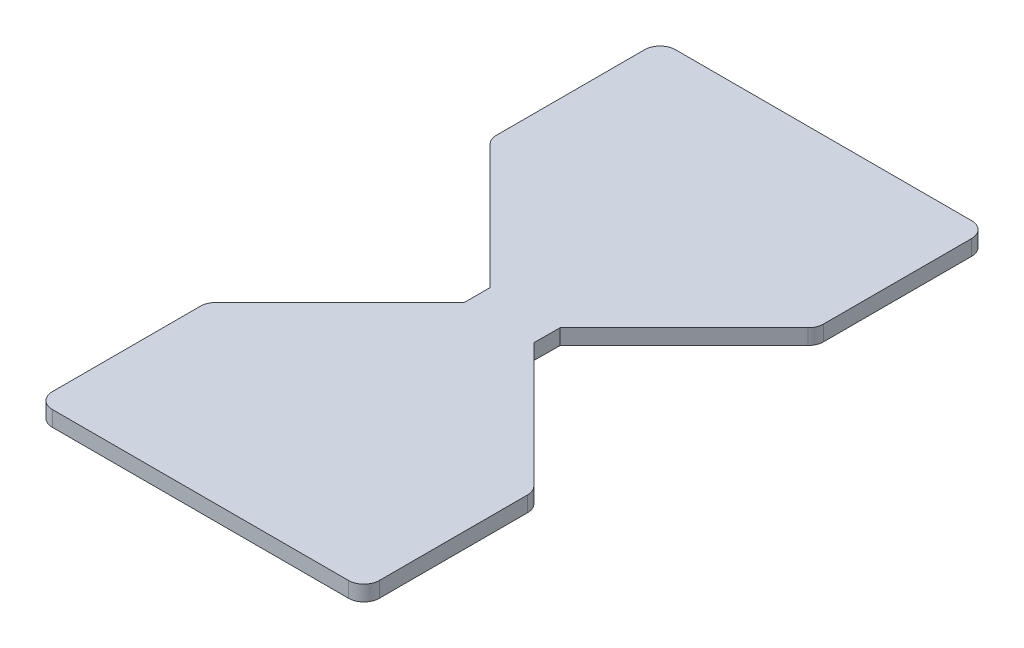
from build123d import *

# Parameters (mm, degrees)
EXTRUDE_1_DEPTH = 2.4


with BuildPart() as part:
    # 草图1 → 凸台-拉伸1 (new body)
    with BuildSketch(Plane(origin=(0, 0, 0), x_dir=(1, 0, 0), z_dir=(0, 1, 0))):
        with BuildLine():
            ThreePointArc((-2.4, 0), (-1.697056275, -1.697056275), (0, -2.4))
            Line((0, -2.4), (46, -2.4))
            ThreePointArc((46, -2.4), (47.697056275, -1.697056275), (48.4, 0))
            Line((48.4, 0), (48.4, 23))
            ThreePointArc((48.4, 23), (48.217310878, 23.918440238), (47.697056275, 24.697056275))
            Line((47.697056275, 24.697056275), (28.408300674, 43.985811875))
            Line((28.408300674, 43.985811875), (28.441701489, 48.047205338))
            Line((28.441701489, 48.047205338), (47.697056275, 67.302560123))
            ThreePointArc((47.697056275, 67.302560123), (48.217310878, 68.08117616), (48.4, 68.999616398))
            Line((48.4, 68.999616398), (48.4, 91.999616398))
            ThreePointArc((48.4, 91.999616398), (47.697056275, 93.696672673), (46, 94.399616398))
            Line((46, 94.399616398), (0, 94.399616398))
            ThreePointArc((0, 94.399616398), (-1.697056275, 93.696672673), (-2.4, 91.999616398))
            Line((-2.4, 91.999616398), (-2.4, 68.999616398))
            ThreePointArc((-2.4, 68.999616398), (-2.217310878, 68.08117616), (-1.697056275, 67.302560123))
            Line((-1.697056275, 67.302560123), (17.599808199, 48.005695649))
            Line((17.599808199, 48.005695649), (17.599808199, 43.993920749))
            Line((17.599808199, 43.993920749), (-1.697056275, 24.697056275))
            ThreePointArc((-1.697056275, 24.697056275), (-2.217310878, 23.918440238), (-2.4, 23))
            Line((-2.4, 23), (-2.4, 0))
        make_face()
    extrude(amount=-EXTRUDE_1_DEPTH)


solid = part.part
